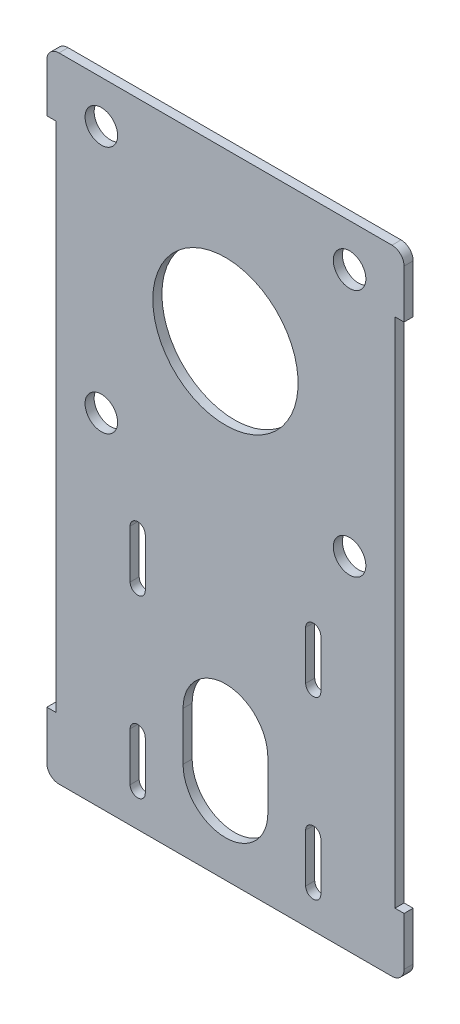
from build123d import *

# Parameters (mm, degrees)
SKETCH1_W          = 187.325
SKETCH1_H          = 332.057083461
EXTRUDE1_DEPTH     = 4.7625
CUT_EXTRUDE1_REACH = 264.098
CUT_EXTRUDE2_REACH = 264.098
SKETCH3_R          = 38.1
SKETCH3_R_2        = 8.5328125
CUT_EXTRUDE3_REACH = 264.098
SKETCH4_W          = 4.7625
SKETCH4_H          = 268.557083461
FILLET1_R          = 6.35


with BuildPart() as part:
    # Sketch1 → Extrude1 (new body)
    with BuildSketch(Plane.XY):
        with Locations((0, -78.716041731)):
            Rectangle(SKETCH1_W, SKETCH1_H)
    extrude(amount=-EXTRUDE1_DEPTH)

    # Sketch2 → Cut-Extrude1 (cut, up to next)
    with BuildSketch(Plane.XY, mode=Mode.PRIVATE) as cut_extrude1_sk1:
        with BuildLine():
            Line((-22.225, -203.2), (-22.225, -177.8))
            ThreePointArc((-22.225, -177.8), (0, -155.575), (22.225, -177.8))
            Line((22.225, -177.8), (22.225, -203.2))
            ThreePointArc((22.225, -203.2), (0, -225.425), (-22.225, -203.2))
        make_face()
    cut_extrude1_tool1 = extrude(cut_extrude1_sk1.sketch, amount=-CUT_EXTRUDE1_REACH, mode=Mode.PRIVATE) & part.part
    # Sketch2 → Cut-Extrude1 (cut, up to next)
    with BuildSketch(Plane.XY, mode=Mode.PRIVATE) as cut_extrude1_sk2:
        with BuildLine():
            Line((49.99355, -108.9152), (49.99355, -134.3152))
            ThreePointArc((49.99355, -134.3152), (46.0248, -138.28395), (42.05605, -134.3152))
            Line((42.05605, -134.3152), (42.05605, -108.9152))
            ThreePointArc((42.05605, -108.9152), (46.0248, -104.94645), (49.99355, -108.9152))
        make_face()
    cut_extrude1_tool2 = extrude(cut_extrude1_sk2.sketch, amount=-CUT_EXTRUDE1_REACH, mode=Mode.PRIVATE) & part.part
    # Sketch2 → Cut-Extrude1 (cut, up to next)
    with BuildSketch(Plane.XY, mode=Mode.PRIVATE) as cut_extrude1_sk3:
        with BuildLine():
            Line((-42.05605, -108.9152), (-42.05605, -134.3152))
            ThreePointArc((-42.05605, -134.3152), (-46.0248, -138.28395), (-49.99355, -134.3152))
            Line((-49.99355, -134.3152), (-49.99355, -108.9152))
            ThreePointArc((-49.99355, -108.9152), (-46.0248, -104.94645), (-42.05605, -108.9152))
        make_face()
    cut_extrude1_tool3 = extrude(cut_extrude1_sk3.sketch, amount=-CUT_EXTRUDE1_REACH, mode=Mode.PRIVATE) & part.part
    # Sketch2 → Cut-Extrude1 (cut, up to next)
    with BuildSketch(Plane.XY, mode=Mode.PRIVATE) as cut_extrude1_sk4:
        with BuildLine():
            Line((49.99355, -200.9648), (49.99355, -226.3648))
            ThreePointArc((49.99355, -226.3648), (46.0248, -230.33355), (42.05605, -226.3648))
            Line((42.05605, -226.3648), (42.05605, -200.9648))
            ThreePointArc((42.05605, -200.9648), (46.0248, -196.99605), (49.99355, -200.9648))
        make_face()
    cut_extrude1_tool4 = extrude(cut_extrude1_sk4.sketch, amount=-CUT_EXTRUDE1_REACH, mode=Mode.PRIVATE) & part.part
    # Sketch2 → Cut-Extrude1 (cut, up to next)
    with BuildSketch(Plane.XY, mode=Mode.PRIVATE) as cut_extrude1_sk5:
        with BuildLine():
            Line((-42.05605, -200.9648), (-42.05605, -226.3648))
            ThreePointArc((-42.05605, -226.3648), (-46.0248, -230.33355), (-49.99355, -226.3648))
            Line((-49.99355, -226.3648), (-49.99355, -200.9648))
            ThreePointArc((-49.99355, -200.9648), (-46.0248, -196.99605), (-42.05605, -200.9648))
        make_face()
    cut_extrude1_tool5 = extrude(cut_extrude1_sk5.sketch, amount=-CUT_EXTRUDE1_REACH, mode=Mode.PRIVATE) & part.part
    add(cut_extrude1_tool1.solids().sort_by_distance((0, -190.5, 0))[0], mode=Mode.SUBTRACT)
    add(cut_extrude1_tool2.solids().sort_by_distance((46.0248, -121.6152, 0))[0], mode=Mode.SUBTRACT)
    add(cut_extrude1_tool3.solids().sort_by_distance((-46.0248, -121.6152, 0))[0], mode=Mode.SUBTRACT)
    add(cut_extrude1_tool4.solids().sort_by_distance((46.0248, -213.6648, 0))[0], mode=Mode.SUBTRACT)
    add(cut_extrude1_tool5.solids().sort_by_distance((-46.0248, -213.6648, 0))[0], mode=Mode.SUBTRACT)

    # Sketch3 → Cut-Extrude2 (cut, up to next)
    with BuildSketch(Plane(origin=(0, 0, 0), x_dir=(-1, 0, 0), z_dir=(0, 0, -1)), mode=Mode.PRIVATE) as cut_extrude2_sk1:
        Circle(SKETCH3_R)
    cut_extrude2_tool1 = extrude(cut_extrude2_sk1.sketch, amount=CUT_EXTRUDE2_REACH, mode=Mode.PRIVATE) & part.part
    # Sketch3 → Cut-Extrude2 (cut, up to next)
    with BuildSketch(Plane(origin=(0, 0, 0), x_dir=(-1, 0, 0), z_dir=(0, 0, -1)), mode=Mode.PRIVATE) as cut_extrude2_sk2:
        with Locations((65.0875, 65.0875)):
            Circle(SKETCH3_R_2)
    cut_extrude2_tool2 = extrude(cut_extrude2_sk2.sketch, amount=CUT_EXTRUDE2_REACH, mode=Mode.PRIVATE) & part.part
    # Sketch3 → Cut-Extrude2 (cut, up to next)
    with BuildSketch(Plane(origin=(0, 0, 0), x_dir=(-1, 0, 0), z_dir=(0, 0, -1)), mode=Mode.PRIVATE) as cut_extrude2_sk3:
        with Locations((-65.0875, 65.0875)):
            Circle(SKETCH3_R_2)
    cut_extrude2_tool3 = extrude(cut_extrude2_sk3.sketch, amount=CUT_EXTRUDE2_REACH, mode=Mode.PRIVATE) & part.part
    # Sketch3 → Cut-Extrude2 (cut, up to next)
    with BuildSketch(Plane(origin=(0, 0, 0), x_dir=(-1, 0, 0), z_dir=(0, 0, -1)), mode=Mode.PRIVATE) as cut_extrude2_sk4:
        with Locations((-65.0875, -65.0875)):
            Circle(SKETCH3_R_2)
    cut_extrude2_tool4 = extrude(cut_extrude2_sk4.sketch, amount=CUT_EXTRUDE2_REACH, mode=Mode.PRIVATE) & part.part
    # Sketch3 → Cut-Extrude2 (cut, up to next)
    with BuildSketch(Plane(origin=(0, 0, 0), x_dir=(-1, 0, 0), z_dir=(0, 0, -1)), mode=Mode.PRIVATE) as cut_extrude2_sk5:
        with Locations((65.0875, -65.0875)):
            Circle(SKETCH3_R_2)
    cut_extrude2_tool5 = extrude(cut_extrude2_sk5.sketch, amount=CUT_EXTRUDE2_REACH, mode=Mode.PRIVATE) & part.part
    add(cut_extrude2_tool1.solids().sort_by_distance((0, 0, 0))[0], mode=Mode.SUBTRACT)
    add(cut_extrude2_tool2.solids().sort_by_distance((-65.0875, 65.0875, 0))[0], mode=Mode.SUBTRACT)
    add(cut_extrude2_tool3.solids().sort_by_distance((65.0875, 65.0875, 0))[0], mode=Mode.SUBTRACT)
    add(cut_extrude2_tool4.solids().sort_by_distance((65.0875, -65.0875, 0))[0], mode=Mode.SUBTRACT)
    add(cut_extrude2_tool5.solids().sort_by_distance((-65.0875, -65.0875, 0))[0], mode=Mode.SUBTRACT)

    # Sketch4 → Cut-Extrude3 (cut, up to next)
    with BuildSketch(Plane(origin=(0, 0, -4.7625), x_dir=(-1, 0, 0), z_dir=(0, 0, -1)), mode=Mode.PRIVATE) as cut_extrude3_sk1:
        with Locations((-91.28125, -78.716041731)):
            Rectangle(SKETCH4_W, SKETCH4_H)
    cut_extrude3_tool1 = extrude(cut_extrude3_sk1.sketch, amount=-CUT_EXTRUDE3_REACH, mode=Mode.PRIVATE) & part.part
    cut_extrude3 = cut_extrude3_tool1.solids().sort_by_distance((91.28125, -78.716042, -4.7625))[0]
    add(cut_extrude3, mode=Mode.SUBTRACT)

    # Mirror1: Cut-Extrude3 across plane
    add(cut_extrude3.mirror(Plane(origin=(0, 0, 0), x_dir=(0, 0, 1), z_dir=(1, 0, 0))), mode=Mode.SUBTRACT)

    # Fillet1
    fillet1_edges = [part.edges().sort_by_distance(p)[0] for p in [
        (-93.6625, 87.3125, -2.38125),
        (-93.6625, -244.744583461, -2.38125),
        (93.6625, -244.744583461, -2.38125),
        (93.6625, 87.3125, -2.38125),
    ]]
    fillet(fillet1_edges, radius=FILLET1_R)


solid = part.part
